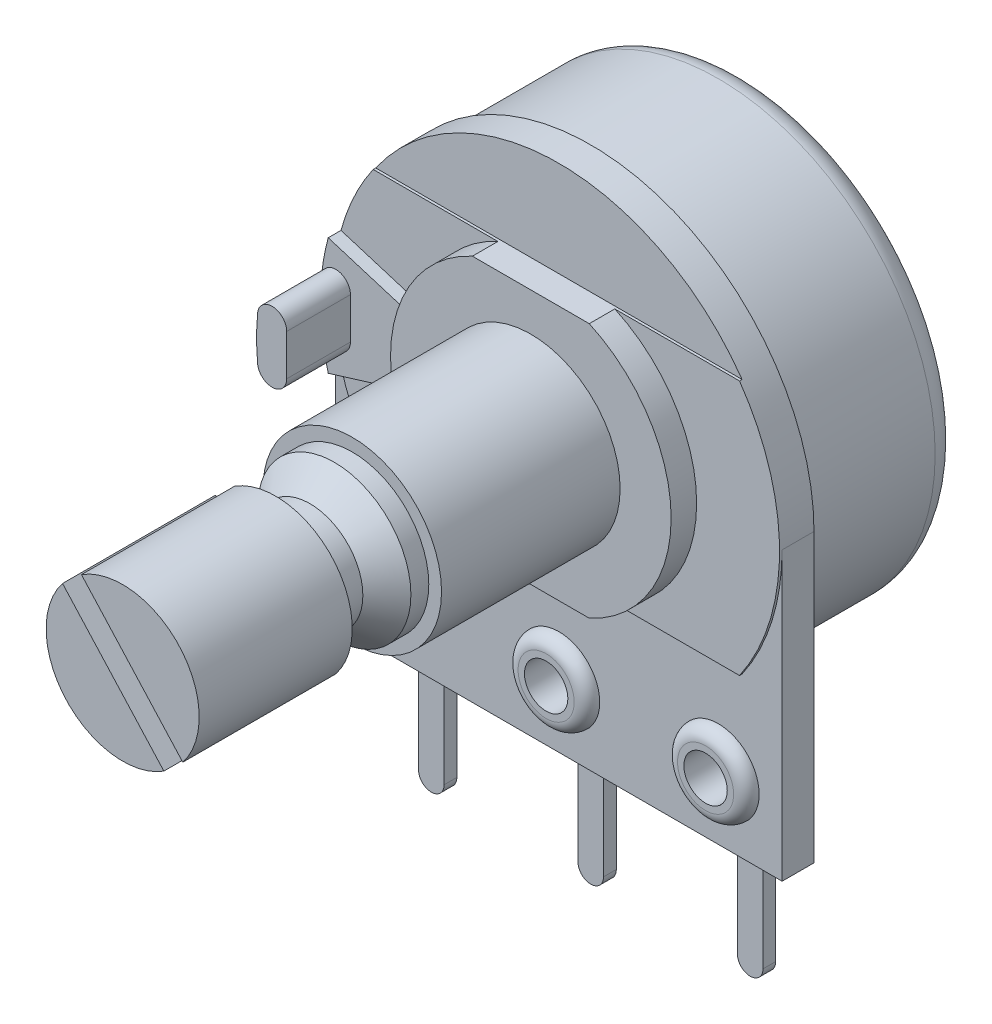
from build123d import *

# Parameters (mm, degrees)
SKETCH1_R            = 8.5
BOSS_EXTRUDE1_DEPTH  = 6
BOSS_EXTRUDE2_DEPTH  = 1.25
SKETCH3_R            = 1.6
SKETCH3_R_2          = 0.85
BOSS_EXTRUDE3_DEPTH  = 0.5
CUT_EXTRUDE1_START   = -1.25
SKETCH5_R            = 0.85
CUT_EXTRUDE1_DEPTH   = 1.25
BOSS_EXTRUDE5_START  = -0.5
BOSS_EXTRUDE5_DEPTH  = 0.5
BOSS_EXTRUDE6_START  = 0.5
SKETCH8_R            = 1.6
SKETCH8_R_2          = 0.85
BOSS_EXTRUDE6_DEPTH  = 0.5
FILLET2_R            = 0.5
BOSS_EXTRUDE7_DEPTH  = 0.1
BOSS_EXTRUDE8_DEPTH  = 1
SKETCH11_R           = 3.5
BOSS_EXTRUDE9_DEPTH  = 7
SKETCH12_R           = 3
BOSS_EXTRUDE10_DEPTH = 3
SKETCH14_R           = 3
BOSS_EXTRUDE11_DEPTH = 6
CUT_EXTRUDE2_DEPTH   = 7
BOSS_EXTRUDE12_DEPTH = 0.5
BOSS_EXTRUDE13_DEPTH = 2.5
FILLET4_R            = 1


# Read off the part's stored shape, not the designer's step: Boss-Extrude13
with BuildPart() as part:
    # Sketch1 → Boss-Extrude1 (new body)
    with BuildSketch(Plane.XY):
        Circle(SKETCH1_R)
    extrude(amount=-BOSS_EXTRUDE1_DEPTH)

    # Sketch2 → Boss-Extrude2 (add)
    with BuildSketch(Plane.XY):
        with BuildLine():
            Line((8.75, 0), (8.75, -11.25))
            Line((8.75, -11.25), (-8.75, -11.25))
            Line((-8.75, -11.25), (-8.75, 0))
            ThreePointArc((-8.75, 0), (0, 8.75), (8.75, 0))
        make_face()
    extrude(amount=BOSS_EXTRUDE2_DEPTH)

    # Sketch3 → Boss-Extrude3 (add)
    # profile 1 of 3: a face of its own
    with BuildSketch(Plane.XY.offset(1.25)):
        with Locations((0, -8.75)):
            Circle(SKETCH3_R)
        with Locations((0, -8.75)):
            Circle(SKETCH3_R_2, mode=Mode.SUBTRACT)
    # profile 2 of 3: a face of its own
    with BuildSketch(Plane.XY.offset(1.25)):
        with Locations((6.25, -8.75)):
            Circle(SKETCH3_R)
        with Locations((6.25, -8.75)):
            Circle(SKETCH3_R_2, mode=Mode.SUBTRACT)
    # profile 3 of 3: a face of its own
    with BuildSketch(Plane.XY.offset(1.25)):
        with Locations((-6.25, -8.75)):
            Circle(SKETCH3_R)
        with Locations((-6.25, -8.75)):
            Circle(SKETCH3_R_2, mode=Mode.SUBTRACT)
    extrude(amount=BOSS_EXTRUDE3_DEPTH)

    # Sketch5 → Cut-Extrude1 (cut)
    with BuildSketch(Plane.XY.offset(1.25).offset(CUT_EXTRUDE1_START)):
        with Locations((-6.25, -8.75)):
            Circle(SKETCH5_R)
        with Locations(Location((0, -8.75, 0), (0, 0, 160.215255231))):
            Circle(SKETCH5_R)
        with Locations((6.25, -8.75)):
            Circle(SKETCH5_R)
    extrude(amount=CUT_EXTRUDE1_DEPTH, mode=Mode.SUBTRACT)

    # Sketch6 → Boss-Extrude5 (add)
    with BuildSketch(Plane.XY.offset(BOSS_EXTRUDE5_START)):
        with BuildLine():
            Line((-6.75, -15.85), (-6.75, -10.269868415))
            ThreePointArc((-6.75, -10.269868415), (-6.25, -10.35), (-5.75, -10.269868415))
            Line((-5.75, -10.269868415), (-5.75, -15.85))
            ThreePointArc((-5.75, -15.85), (-6.25, -16.35), (-6.75, -15.85))
        make_face()
        with BuildLine():
            Line((-0.5, -15.85), (-0.5, -10.269868415))
            ThreePointArc((-0.5, -10.269868415), (0, -10.35), (0.5, -10.269868415))
            Line((0.5, -10.269868415), (0.5, -15.85))
            ThreePointArc((0.5, -15.85), (0, -16.35), (-0.5, -15.85))
        make_face()
        with BuildLine():
            Line((5.75, -15.85), (5.75, -10.269868415))
            ThreePointArc((5.75, -10.269868415), (6.25, -10.35), (6.75, -10.269868415))
            Line((6.75, -10.269868415), (6.75, -15.85))
            ThreePointArc((6.75, -15.85), (6.25, -16.35), (5.75, -15.85))
        make_face()
    extrude(amount=BOSS_EXTRUDE5_DEPTH)

    # Sketch8 → Boss-Extrude6 (add)
    # profile 1 of 3: a face of its own
    with BuildSketch(Plane(origin=(0, 0, 0), x_dir=(-1, 0, 0), z_dir=(0, 0, -1)).offset(BOSS_EXTRUDE6_START)):
        with Locations(Location((-6.25, -8.75, 0), (0, 0, 180))):
            Circle(SKETCH8_R)
        with Locations(Location((-6.25, -8.75, 0), (0, 0, 180))):
            Circle(SKETCH8_R_2, mode=Mode.SUBTRACT)
    # profile 2 of 3: a face of its own
    with BuildSketch(Plane(origin=(0, 0, 0), x_dir=(-1, 0, 0), z_dir=(0, 0, -1)).offset(BOSS_EXTRUDE6_START)):
        with Locations(Location((0, -8.75, 0), (0, 0, 180))):
            Circle(SKETCH8_R)
        with Locations(Location((0, -8.75, 0), (0, 0, 19.784744769))):
            Circle(SKETCH8_R_2, mode=Mode.SUBTRACT)
    # profile 3 of 3: a face of its own
    with BuildSketch(Plane(origin=(0, 0, 0), x_dir=(-1, 0, 0), z_dir=(0, 0, -1)).offset(BOSS_EXTRUDE6_START)):
        with Locations(Location((6.25, -8.75, 0), (0, 0, 180))):
            Circle(SKETCH8_R)
        with Locations(Location((6.25, -8.75, 0), (0, 0, 180))):
            Circle(SKETCH8_R_2, mode=Mode.SUBTRACT)
    extrude(amount=-BOSS_EXTRUDE6_DEPTH)

    # Fillet2
    fillet2_edges = [part.edges().sort_by_distance(p)[0] for p in [
        (-1.6, -8.75, 1.75),
        (4.65, -8.75, 1.75),
        (-7.85, -8.75, 1.75),
    ]]
    fillet(fillet2_edges, radius=FILLET2_R - 0.0001)  # a hair under: the kernel refuses the full size

    # Sketch9 → Boss-Extrude7 (add)
    with BuildSketch(Plane.XY.offset(1.25)):
        with BuildLine():
            Line((-7.180703308, 5), (7.180703308, 5))
            ThreePointArc((7.180703308, 5), (8.75, 0), (7.180703308, -5))
            Line((7.180703308, -5), (-7.180703308, -5))
            ThreePointArc((-7.180703308, -5), (-8.75, 0), (-7.180703308, 5))
        make_face()
    extrude(amount=BOSS_EXTRUDE7_DEPTH)

    # Sketch10 → Boss-Extrude8 (add)
    with BuildSketch(Plane.XY.offset(1.35)):
        with BuildLine():
            Line((2.291287847, 5), (-2.291287847, 5))
            ThreePointArc((-2.291287847, 5), (-5.5, 0), (-2.291287847, -5))
            Line((-2.291287847, -5), (2.291287847, -5))
            ThreePointArc((2.291287847, -5), (5.5, 0), (2.291287847, 5))
        make_face()
    extrude(amount=BOSS_EXTRUDE8_DEPTH)

    # Sketch11 → Boss-Extrude9 (add)
    with BuildSketch(Plane.XY.offset(2.35)):
        Circle(SKETCH11_R)
    extrude(amount=BOSS_EXTRUDE9_DEPTH)

    # Sketch12 → Boss-Extrude10 (add)
    with BuildSketch(Plane.XY.offset(9.35)):
        Circle(SKETCH12_R)
    extrude(amount=BOSS_EXTRUDE10_DEPTH)

    # Sketch13 → Cut-Revolve2 (revolve, cut)
    with BuildSketch(Plane(origin=(0, 0, 0), x_dir=(1, 0, 0), z_dir=(0, 1, 0))):
        Polygon((2.076228104, -11.010865145), (2.076228104, -12.35), (3, -12.35), (3, -10.050978955), align=None)
    revolve(axis=Axis((0, 0, 12.35), (0, 0, -1)), mode=Mode.SUBTRACT)

    # Sketch14 → Boss-Extrude11 (add)
    with BuildSketch(Plane.XY.offset(12.35)):
        Circle(SKETCH14_R)
    extrude(amount=BOSS_EXTRUDE11_DEPTH)

    # Sketch15 → Cut-Extrude2 (cut)
    with BuildSketch(Plane.XY.offset(18.35)):
        Polygon((-3.122971825, 2.701860488), (2.385287248, -3.377006001), (3.122971825, -2.701860488), (-2.385287248, 3.377006001), align=None)
    extrude(amount=-CUT_EXTRUDE2_DEPTH, mode=Mode.SUBTRACT)

    # Sketch16 → Boss-Extrude12 (add)
    with BuildSketch(Plane.XY.offset(1.35)):
        with BuildLine():
            Line((-8.442304188, 2.3), (-5.333008063, 1.345))
            ThreePointArc((-5.333008063, 1.345), (-5.5, 0), (-5.333008063, -1.345))
            Line((-5.333008063, -1.345), (-8.442304188, -2.3))
            ThreePointArc((-8.442304188, -2.3), (-8.749950498, 0), (-8.442304188, 2.3))
        make_face()
    extrude(amount=BOSS_EXTRUDE12_DEPTH)

    # Boss-Extrude13 outline → Boss-Extrude13 (add)
    with BuildSketch(Plane.XY.offset(1.85)):
        with BuildLine():
            ThreePointArc((-8.701900167, 0.915807021), (-8.749950498, 0), (-8.701900167, -0.915807021))
            ThreePointArc((-8.701900167, -0.915807021), (-8.085984441, -1.372236974), (-7.571237459, -0.804155968))
            Line((-7.571237459, -0.804155968), (-7.571237459, 0.804155968))
            ThreePointArc((-7.571237459, 0.804155968), (-8.085984441, 1.372236974), (-8.701900167, 0.915807021))
        make_face()
    extrude(amount=BOSS_EXTRUDE13_DEPTH)

    # Fillet4
    fillet4_edges = [part.edges().sort_by_distance(p)[0] for p in [
        (-8.5, 0, -6),
    ]]
    fillet(fillet4_edges, radius=FILLET4_R)


solid = part.part
